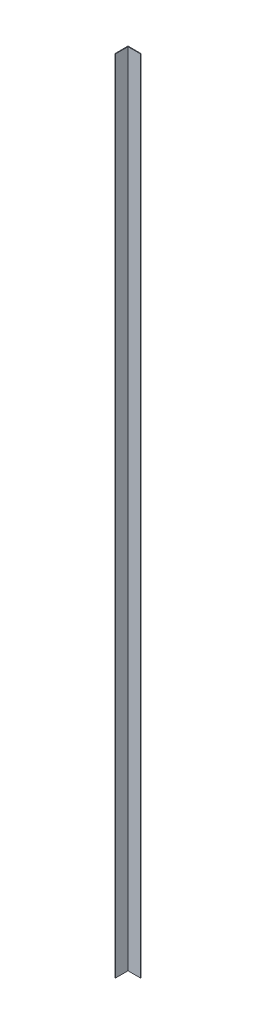
from build123d import *

# Parameters (mm, degrees)
BOSS_EXTRUDE1_DEPTH = 417.195


with BuildPart() as part:
    # Sketch1 → Boss-Extrude1 (new body)
    with BuildSketch(Plane(origin=(0, 0, 0), x_dir=(1, 0, 0), z_dir=(0, 1, 0))):
        Polygon((0, 0), (6.5, 0), (6.5, 0.3048), (-0.3048, 0.3048), (-0.3048, -6.5), (0, -6.5), align=None)
    extrude(amount=BOSS_EXTRUDE1_DEPTH)


solid = part.part
